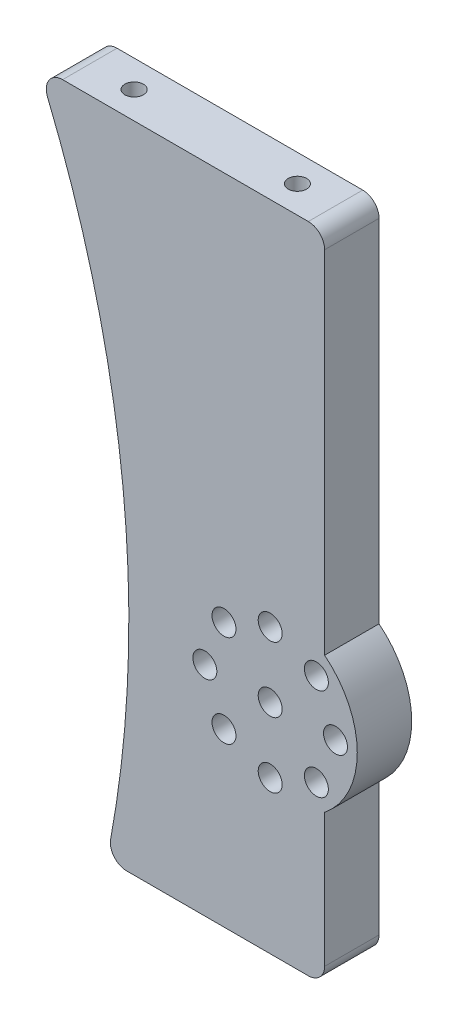
from build123d import *

# Parameters (mm, degrees)
SKETCH_1_R          = 1.1
EXTRUDE_1_DEPTH     = 5
EXTRUDE_2_DEPTH     = 5
FILLET_1_R          = 1.5
SKETCH_3_R          = 0.85
CUT_EXTRUDE_1_DEPTH = 10
CUT_EXTRUDE_START   = -10
SKETCH_4_R          = 0.85
CUT_EXTRUDE_2_DEPTH = 10


with BuildPart() as part:
    # ｽｹｯﾁ1 → ﾎﾞｽ - 押し出し1 (new body)
    with BuildSketch(Plane.XY):
        with BuildLine():
            Line((-5, 60), (5, 60))
            Line((5, 60), (5, 26.244997998))
            ThreePointArc((5, 26.244997998), (8, 20), (5, 13.755002002))
            Line((5, 13.755002002), (5, 0))
            Line((5, 0), (-5, 0))
            Line((-5, 0), (-5, 13.755002002))
            ThreePointArc((-5, 13.755002002), (-8, 20), (-5, 26.244997998))
            Line((-5, 26.244997998), (-5, 60))
        make_face()
        with Locations((0, 20)):
            Circle(SKETCH_1_R, mode=Mode.SUBTRACT)
        with Locations((0, 26)):
            Circle(SKETCH_1_R, mode=Mode.SUBTRACT)
        with Locations((4.242640687, 24.242640687)):
            Circle(SKETCH_1_R, mode=Mode.SUBTRACT)
        with Locations((6, 20)):
            Circle(SKETCH_1_R, mode=Mode.SUBTRACT)
        with Locations((4.242640687, 15.757359313)):
            Circle(SKETCH_1_R, mode=Mode.SUBTRACT)
        with Locations((0, 14)):
            Circle(SKETCH_1_R, mode=Mode.SUBTRACT)
        with Locations((-4.242640687, 15.757359313)):
            Circle(SKETCH_1_R, mode=Mode.SUBTRACT)
        with Locations((-6, 20)):
            Circle(SKETCH_1_R, mode=Mode.SUBTRACT)
        with Locations((-4.242640687, 24.242640687)):
            Circle(SKETCH_1_R, mode=Mode.SUBTRACT)
    extrude(amount=EXTRUDE_1_DEPTH)

    # ｽｹｯﾁ2 → ﾎﾞｽ - 押し出し2 (add)
    with BuildSketch(Plane(origin=(0, 0, 0), x_dir=(-1, 0, 0), z_dir=(0, 0, -1))):
        with BuildLine():
            Line((5, 60), (21.328075812, 60))
            ThreePointArc((21.328075812, 60), (13.531166576, 30.48861935), (15, 0))
            Line((15, 0), (5, 0))
            Line((5, 0), (5, 13.755002002))
            ThreePointArc((5, 13.755002002), (8, 20), (5, 26.244997998))
            Line((5, 26.244997998), (5, 60))
        make_face()
    extrude(amount=-EXTRUDE_2_DEPTH)

    # ﾌｨﾚｯﾄ1
    fillet_1_edges = [part.edges().sort_by_distance(p)[0] for p in [
        (-15, 0, 2.5),
        (-21.328075812, 60, 2.5),
        (5, 60, 2.5),
        (5, 0, 2.5),
    ]]
    fillet(fillet_1_edges, radius=FILLET_1_R)

    # ｽｹｯﾁ3 → ｶｯﾄ - 押し出し1 (cut)
    with BuildSketch(Plane.XZ):
        with Locations((0, 2.5)):
            Circle(SKETCH_3_R)
        with Locations((-10, 2.5)):
            Circle(SKETCH_3_R)
    extrude(amount=-CUT_EXTRUDE_1_DEPTH, mode=Mode.SUBTRACT)

    # ｽｹｯﾁ4 → ｶｯﾄ - 押し出し2 (cut)
    with BuildSketch(Plane(origin=(0, 60, 0), x_dir=(1, 0, 0), z_dir=(0, 1, 0)).offset(CUT_EXTRUDE_START)):
        with Locations((0, -2.5)):
            Circle(SKETCH_4_R)
        with Locations((-15, -2.5)):
            Circle(SKETCH_4_R)
    extrude(amount=CUT_EXTRUDE_2_DEPTH, mode=Mode.SUBTRACT)


solid = part.part
